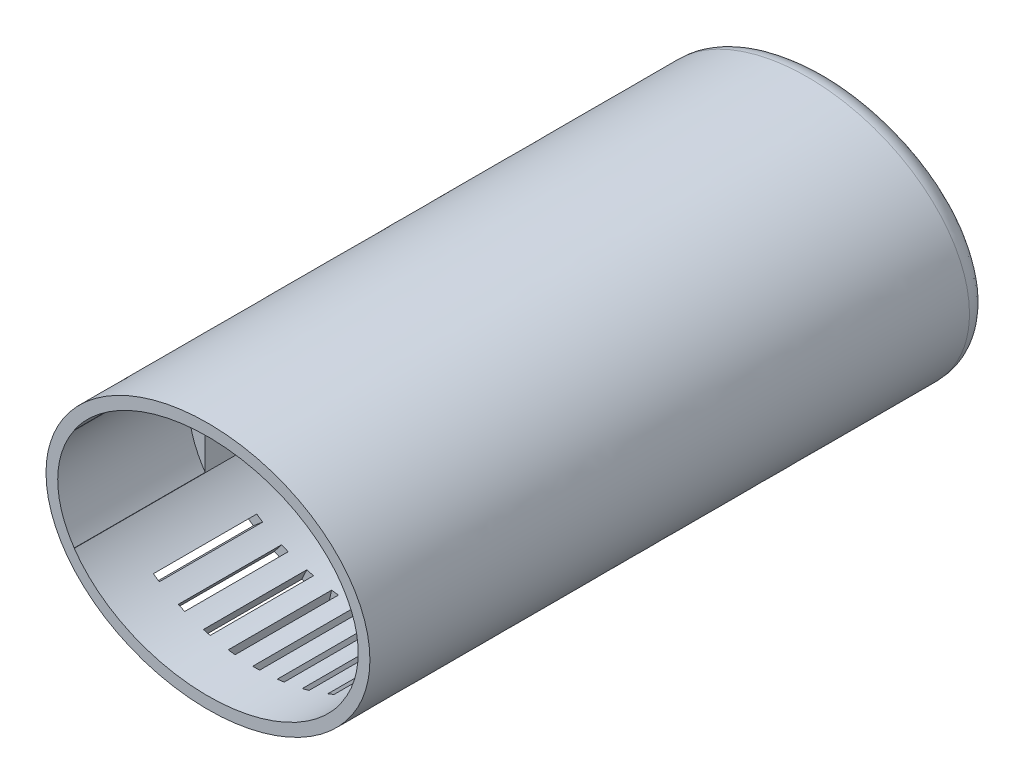
from build123d import *

# Parameters (mm, degrees)
SKIZZE1_RX                      = 23.5
SKIZZE1_RY                      = 18
AUFSATZ_LINEAR_AUSTRAGEN1_DEPTH = 90
SCHNITT_LINEAR_AUSTRAGEN1_DEPTH = 88.5
SKIZZE3_W                       = 3
SKIZZE3_H                       = 3
AUFSATZ_LINEAR_AUSTRAGEN2_DEPTH = 60
VERRUNDUNG1_R                   = 3
SCHNITT_LINEAR_START            = -7
SKIZZE4_W                       = 1
SKIZZE4_H                       = 10.674282936
SCHNITT_LINEAR_AUSTRAGEN2_DEPTH = 15
LINEARES_MUSTER1_COUNT          = 2
LINEARES_MUSTER1_PITCH          = 60
SKIZZE5_RX                      = 21.8
SKIZZE5_RY                      = 16.2
SCHNITT_LINEAR_AUSTRAGEN3_DEPTH = 19
FASE1_SIZE                      = 3
VERRUNDUNG2_R                   = 1
VERRUNDUNG3_R                   = 1


with BuildPart() as part:
    # Skizze1 → Aufsatz-Linear austragen1 (new body)
    with BuildSketch(Plane.XY):
        with Locations((0, 0)):
            Ellipse(SKIZZE1_RX, SKIZZE1_RY)
    extrude(amount=AUFSATZ_LINEAR_AUSTRAGEN1_DEPTH)

    # Skizze2 → Schnitt-Linear austragen1 (cut)
    with BuildSketch(Plane.XY.offset(90)):
        with BuildLine():
            Line((-19.4, 7.435074759), (-19.4, -7.435074759))
            add(Edge.make_bspline(
                [(-19.4, -7.435074759), (0, -35.734677675), (19.4, -7.435074759)],
                knots=[3.61524498, 3.61524498, 3.61524498, 5.809532981, 5.809532981, 5.809532981], degree=2, weights=[1, 0.456139556, 1]))
            Line((19.4, -7.435074759), (19.4, 7.435074759))
            add(Edge.make_bspline(
                [(19.4, 7.435074759), (0, 35.734677675), (-19.4, 7.435074759)],
                knots=[0.473652326, 0.473652326, 0.473652326, 2.667940327, 2.667940327, 2.667940327], degree=2, weights=[1, 0.456139556, 1]))
        make_face()
    extrude(amount=-SCHNITT_LINEAR_AUSTRAGEN1_DEPTH, mode=Mode.SUBTRACT)

    # Skizze3 → Aufsatz-Linear austragen2 (add)
    with BuildSketch(Plane.XY.offset(1.5)):
        with Locations((-17.9, 2)):
            Rectangle(SKIZZE3_W, SKIZZE3_H)
        with Locations((17.9, 2)):
            Rectangle(SKIZZE3_W, SKIZZE3_H)
    extrude(amount=AUFSATZ_LINEAR_AUSTRAGEN2_DEPTH)

    # Verrundung1
    verrundung1_edges = [part.edges().sort_by_distance(p)[0] for p in [
        (-23.499999114, -0.004943852, 0),
    ]]
    fillet(verrundung1_edges, radius=VERRUNDUNG1_R)

    # Skizze4 → Schnitt-Linear austragen2 (cut)
    with BuildSketch(Plane.XY.offset(90).offset(SCHNITT_LINEAR_START)):
        Polygon((-1.880846388, -10.811443856), (-2.857142396, -10.595004242), (-5.167480073, -21.016264051), (-4.191184066, -21.232703665), align=None)
        with Locations((0, -16.3)):
            Rectangle(SKIZZE4_W, SKIZZE4_H)
        Polygon((-4.172485077, -10.148308839), (-5.078792864, -9.725690577), (-9.589939764, -19.399876323), (-8.683631977, -19.822494585), align=None)
        Polygon((-6.266274092, -9.004891377), (-7.059627432, -8.396129948), (-13.557719166, -16.86460797), (-12.764365825, -17.473369399), align=None)
        Polygon((-8.062951112, -7.435398588), (-8.705738722, -6.669354145), (-16.882713849, -13.530650958), (-16.239926239, -14.296695402), align=None)
        Polygon((2.860944872, -10.594775204), (1.884648865, -10.811214818), (4.194986543, -21.232474628), (5.17128255, -21.016035014), align=None)
        Polygon((5.08625811, -9.724414925), (4.179950323, -10.147033187), (8.691097223, -19.821218933), (9.59740501, -19.398600671), align=None)
        Polygon((7.070442096, -8.393039721), (6.277088756, -9.00180115), (12.77518049, -17.470279173), (13.56853383, -16.861517744), align=None)
        Polygon((8.719430664, -6.66376741), (8.076643054, -7.429811853), (16.253618182, -14.291108666), (16.896405791, -13.525064223), align=None)
    schnitt_linear_austragen2 = extrude(amount=-SCHNITT_LINEAR_AUSTRAGEN2_DEPTH, mode=Mode.SUBTRACT)

    # Lineares Muster1: Schnitt-Linear austragen2 ×2
    with Locations(*[(0, 0, -i * LINEARES_MUSTER1_PITCH) for i in range(1, LINEARES_MUSTER1_COUNT)]):
        add(schnitt_linear_austragen2, mode=Mode.SUBTRACT)

    # Skizze5 → Schnitt-Linear austragen3 (cut)
    with BuildSketch(Plane.XY.offset(90)):
        with Locations(Location((0, 0), (0, 0, 0))):
            Ellipse(SKIZZE5_RX, SKIZZE5_RY)
    extrude(amount=-SCHNITT_LINEAR_AUSTRAGEN3_DEPTH, mode=Mode.SUBTRACT)

    # Fase1
    fase1_edges = [part.edges().sort_by_distance(p)[0] for p in [
        (-19.4, 2, 61.5),
        (19.4, 2, 61.5),
    ]]
    chamfer(fase1_edges, length=FASE1_SIZE - 0.0001)  # a hair under: the kernel refuses the full size

    # Verrundung2
    verrundung2_edges = [part.edges().sort_by_distance(p)[0] for p in [
        (0.000721674, -16.299999991, 1.5),
    ]]
    fillet(verrundung2_edges, radius=VERRUNDUNG2_R)

    # Verrundung3
    verrundung3_edges = [part.edges().sort_by_distance(p)[0] for p in [
        (-0.000721674, 16.299999991, 1.5),
    ]]
    fillet(verrundung3_edges, radius=VERRUNDUNG3_R)


solid = part.part
